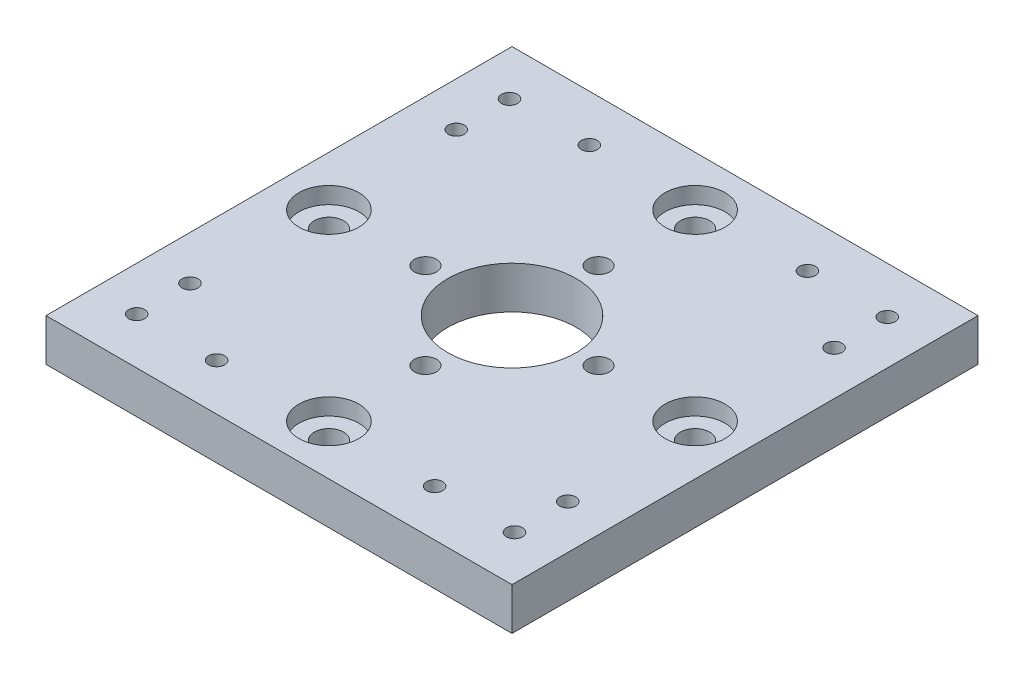
from build123d import *

# Parameters (mm, degrees)
SKETCH1_W           = 70
SKETCH1_H           = 70
SKETCH1_R           = 1.65
BOSS_EXTRUDE1_DEPTH = 6.35
CUT_EXTRUDE1_REACH  = 51.903
SKETCH2_R           = 1.2
CUT_EXTRUDE2_REACH  = 51.903
SKETCH3_R           = 9.65
CUT_EXTRUDE3_REACH  = 51.903
SKETCH4_R           = 2.2
SKETCH5_R           = 4.5
CUT_EXTRUDE4_DEPTH  = 2.5


with BuildPart() as part:
    # Sketch1 → Boss-Extrude1 (new body)
    with BuildSketch(Plane(origin=(0, 0, 0), x_dir=(1, 0, 0), z_dir=(0, 1, 0))):
        Rectangle(SKETCH1_W, SKETCH1_H)
        with Locations((0, 13)):
            Circle(SKETCH1_R, mode=Mode.SUBTRACT)
        with Locations((-13, 0)):
            Circle(SKETCH1_R, mode=Mode.SUBTRACT)
        with Locations((0, -13)):
            Circle(SKETCH1_R, mode=Mode.SUBTRACT)
        with Locations((13, 0)):
            Circle(SKETCH1_R, mode=Mode.SUBTRACT)
    extrude(amount=BOSS_EXTRUDE1_DEPTH)

    # Sketch2 → Cut-Extrude1 (cut, up to next)
    with BuildSketch(Plane(origin=(0, 6.35, 0), x_dir=(1, 0, 0), z_dir=(0, 1, 0)), mode=Mode.PRIVATE) as cut_extrude1_sk1:
        with Locations((16.375, 28)):
            Circle(SKETCH2_R)
    cut_extrude1_tool1 = extrude(cut_extrude1_sk1.sketch, amount=-CUT_EXTRUDE1_REACH, mode=Mode.PRIVATE) & part.part
    # Sketch2 → Cut-Extrude1 (cut, up to next)
    with BuildSketch(Plane(origin=(0, 6.35, 0), x_dir=(1, 0, 0), z_dir=(0, 1, 0)), mode=Mode.PRIVATE) as cut_extrude1_sk2:
        with Locations((28.375, 28)):
            Circle(SKETCH2_R)
    cut_extrude1_tool2 = extrude(cut_extrude1_sk2.sketch, amount=-CUT_EXTRUDE1_REACH, mode=Mode.PRIVATE) & part.part
    # Sketch2 → Cut-Extrude1 (cut, up to next)
    with BuildSketch(Plane(origin=(0, 6.35, 0), x_dir=(1, 0, 0), z_dir=(0, 1, 0)), mode=Mode.PRIVATE) as cut_extrude1_sk3:
        with Locations((28.375, 20)):
            Circle(SKETCH2_R)
    cut_extrude1_tool3 = extrude(cut_extrude1_sk3.sketch, amount=-CUT_EXTRUDE1_REACH, mode=Mode.PRIVATE) & part.part
    # Sketch2 → Cut-Extrude1 (cut, up to next)
    with BuildSketch(Plane(origin=(0, 6.35, 0), x_dir=(1, 0, 0), z_dir=(0, 1, 0)), mode=Mode.PRIVATE) as cut_extrude1_sk4:
        with Locations((-28.375, 20)):
            Circle(SKETCH2_R)
    cut_extrude1_tool4 = extrude(cut_extrude1_sk4.sketch, amount=-CUT_EXTRUDE1_REACH, mode=Mode.PRIVATE) & part.part
    # Sketch2 → Cut-Extrude1 (cut, up to next)
    with BuildSketch(Plane(origin=(0, 6.35, 0), x_dir=(1, 0, 0), z_dir=(0, 1, 0)), mode=Mode.PRIVATE) as cut_extrude1_sk5:
        with Locations((-28.375, 28)):
            Circle(SKETCH2_R)
    cut_extrude1_tool5 = extrude(cut_extrude1_sk5.sketch, amount=-CUT_EXTRUDE1_REACH, mode=Mode.PRIVATE) & part.part
    # Sketch2 → Cut-Extrude1 (cut, up to next)
    with BuildSketch(Plane(origin=(0, 6.35, 0), x_dir=(1, 0, 0), z_dir=(0, 1, 0)), mode=Mode.PRIVATE) as cut_extrude1_sk6:
        with Locations((-16.375, 28)):
            Circle(SKETCH2_R)
    cut_extrude1_tool6 = extrude(cut_extrude1_sk6.sketch, amount=-CUT_EXTRUDE1_REACH, mode=Mode.PRIVATE) & part.part
    # Sketch2 → Cut-Extrude1 (cut, up to next)
    with BuildSketch(Plane(origin=(0, 6.35, 0), x_dir=(1, 0, 0), z_dir=(0, 1, 0)), mode=Mode.PRIVATE) as cut_extrude1_sk7:
        with Locations((28.375, -20)):
            Circle(SKETCH2_R)
    cut_extrude1_tool7 = extrude(cut_extrude1_sk7.sketch, amount=-CUT_EXTRUDE1_REACH, mode=Mode.PRIVATE) & part.part
    # Sketch2 → Cut-Extrude1 (cut, up to next)
    with BuildSketch(Plane(origin=(0, 6.35, 0), x_dir=(1, 0, 0), z_dir=(0, 1, 0)), mode=Mode.PRIVATE) as cut_extrude1_sk8:
        with Locations((28.375, -28)):
            Circle(SKETCH2_R)
    cut_extrude1_tool8 = extrude(cut_extrude1_sk8.sketch, amount=-CUT_EXTRUDE1_REACH, mode=Mode.PRIVATE) & part.part
    # Sketch2 → Cut-Extrude1 (cut, up to next)
    with BuildSketch(Plane(origin=(0, 6.35, 0), x_dir=(1, 0, 0), z_dir=(0, 1, 0)), mode=Mode.PRIVATE) as cut_extrude1_sk9:
        with Locations((16.375, -28)):
            Circle(SKETCH2_R)
    cut_extrude1_tool9 = extrude(cut_extrude1_sk9.sketch, amount=-CUT_EXTRUDE1_REACH, mode=Mode.PRIVATE) & part.part
    # Sketch2 → Cut-Extrude1 (cut, up to next)
    with BuildSketch(Plane(origin=(0, 6.35, 0), x_dir=(1, 0, 0), z_dir=(0, 1, 0)), mode=Mode.PRIVATE) as cut_extrude1_sk10:
        with Locations((-16.375, -28)):
            Circle(SKETCH2_R)
    cut_extrude1_tool10 = extrude(cut_extrude1_sk10.sketch, amount=-CUT_EXTRUDE1_REACH, mode=Mode.PRIVATE) & part.part
    # Sketch2 → Cut-Extrude1 (cut, up to next)
    with BuildSketch(Plane(origin=(0, 6.35, 0), x_dir=(1, 0, 0), z_dir=(0, 1, 0)), mode=Mode.PRIVATE) as cut_extrude1_sk11:
        with Locations((-28.375, -20)):
            Circle(SKETCH2_R)
    cut_extrude1_tool11 = extrude(cut_extrude1_sk11.sketch, amount=-CUT_EXTRUDE1_REACH, mode=Mode.PRIVATE) & part.part
    # Sketch2 → Cut-Extrude1 (cut, up to next)
    with BuildSketch(Plane(origin=(0, 6.35, 0), x_dir=(1, 0, 0), z_dir=(0, 1, 0)), mode=Mode.PRIVATE) as cut_extrude1_sk12:
        with Locations((-28.375, -28)):
            Circle(SKETCH2_R)
    cut_extrude1_tool12 = extrude(cut_extrude1_sk12.sketch, amount=-CUT_EXTRUDE1_REACH, mode=Mode.PRIVATE) & part.part
    add(cut_extrude1_tool1.solids().sort_by_distance((16.375, 6.35, -28))[0], mode=Mode.SUBTRACT)
    add(cut_extrude1_tool2.solids().sort_by_distance((28.375, 6.35, -28))[0], mode=Mode.SUBTRACT)
    add(cut_extrude1_tool3.solids().sort_by_distance((28.375, 6.35, -20))[0], mode=Mode.SUBTRACT)
    add(cut_extrude1_tool4.solids().sort_by_distance((-28.375, 6.35, -20))[0], mode=Mode.SUBTRACT)
    add(cut_extrude1_tool5.solids().sort_by_distance((-28.375, 6.35, -28))[0], mode=Mode.SUBTRACT)
    add(cut_extrude1_tool6.solids().sort_by_distance((-16.375, 6.35, -28))[0], mode=Mode.SUBTRACT)
    add(cut_extrude1_tool7.solids().sort_by_distance((28.375, 6.35, 20))[0], mode=Mode.SUBTRACT)
    add(cut_extrude1_tool8.solids().sort_by_distance((28.375, 6.35, 28))[0], mode=Mode.SUBTRACT)
    add(cut_extrude1_tool9.solids().sort_by_distance((16.375, 6.35, 28))[0], mode=Mode.SUBTRACT)
    add(cut_extrude1_tool10.solids().sort_by_distance((-16.375, 6.35, 28))[0], mode=Mode.SUBTRACT)
    add(cut_extrude1_tool11.solids().sort_by_distance((-28.375, 6.35, 20))[0], mode=Mode.SUBTRACT)
    add(cut_extrude1_tool12.solids().sort_by_distance((-28.375, 6.35, 28))[0], mode=Mode.SUBTRACT)

    # Sketch3 → Cut-Extrude2 (cut, up to next)
    with BuildSketch(Plane(origin=(0, 6.35, 0), x_dir=(1, 0, 0), z_dir=(0, 1, 0)), mode=Mode.PRIVATE) as cut_extrude2_sk1:
        Circle(SKETCH3_R)
    cut_extrude2_tool1 = extrude(cut_extrude2_sk1.sketch, amount=-CUT_EXTRUDE2_REACH, mode=Mode.PRIVATE) & part.part
    add(cut_extrude2_tool1.solids().sort_by_distance((0, 6.35, 0))[0], mode=Mode.SUBTRACT)

    # Sketch4 → Cut-Extrude3 (cut, up to next)
    with BuildSketch(Plane(origin=(0, 6.35, 0), x_dir=(1, 0, 0), z_dir=(0, 1, 0)), mode=Mode.PRIVATE) as cut_extrude3_sk1:
        with Locations((27.5, 0)):
            Circle(SKETCH4_R)
    cut_extrude3_tool1 = extrude(cut_extrude3_sk1.sketch, amount=-CUT_EXTRUDE3_REACH, mode=Mode.PRIVATE) & part.part
    # Sketch4 → Cut-Extrude3 (cut, up to next)
    with BuildSketch(Plane(origin=(0, 6.35, 0), x_dir=(1, 0, 0), z_dir=(0, 1, 0)), mode=Mode.PRIVATE) as cut_extrude3_sk2:
        with Locations((0, 27.5)):
            Circle(SKETCH4_R)
    cut_extrude3_tool2 = extrude(cut_extrude3_sk2.sketch, amount=-CUT_EXTRUDE3_REACH, mode=Mode.PRIVATE) & part.part
    # Sketch4 → Cut-Extrude3 (cut, up to next)
    with BuildSketch(Plane(origin=(0, 6.35, 0), x_dir=(1, 0, 0), z_dir=(0, 1, 0)), mode=Mode.PRIVATE) as cut_extrude3_sk3:
        with Locations((0, -27.5)):
            Circle(SKETCH4_R)
    cut_extrude3_tool3 = extrude(cut_extrude3_sk3.sketch, amount=-CUT_EXTRUDE3_REACH, mode=Mode.PRIVATE) & part.part
    # Sketch4 → Cut-Extrude3 (cut, up to next)
    with BuildSketch(Plane(origin=(0, 6.35, 0), x_dir=(1, 0, 0), z_dir=(0, 1, 0)), mode=Mode.PRIVATE) as cut_extrude3_sk4:
        with Locations((-27.5, 0)):
            Circle(SKETCH4_R)
    cut_extrude3_tool4 = extrude(cut_extrude3_sk4.sketch, amount=-CUT_EXTRUDE3_REACH, mode=Mode.PRIVATE) & part.part
    add(cut_extrude3_tool1.solids().sort_by_distance((27.5, 6.35, 0))[0], mode=Mode.SUBTRACT)
    add(cut_extrude3_tool2.solids().sort_by_distance((0, 6.35, -27.5))[0], mode=Mode.SUBTRACT)
    add(cut_extrude3_tool3.solids().sort_by_distance((0, 6.35, 27.5))[0], mode=Mode.SUBTRACT)
    add(cut_extrude3_tool4.solids().sort_by_distance((-27.5, 6.35, 0))[0], mode=Mode.SUBTRACT)

    # Sketch5 → Cut-Extrude4 (cut)
    with BuildSketch(Plane(origin=(0, 6.35, 0), x_dir=(1, 0, 0), z_dir=(0, 1, 0))):
        with Locations((0, 27.5)):
            Circle(SKETCH5_R)
        with Locations((27.5, 0)):
            Circle(SKETCH5_R)
        with Locations((0, -27.5)):
            Circle(SKETCH5_R)
        with Locations((-27.5, 0)):
            Circle(SKETCH5_R)
    extrude(amount=-CUT_EXTRUDE4_DEPTH, mode=Mode.SUBTRACT)


solid = part.part
